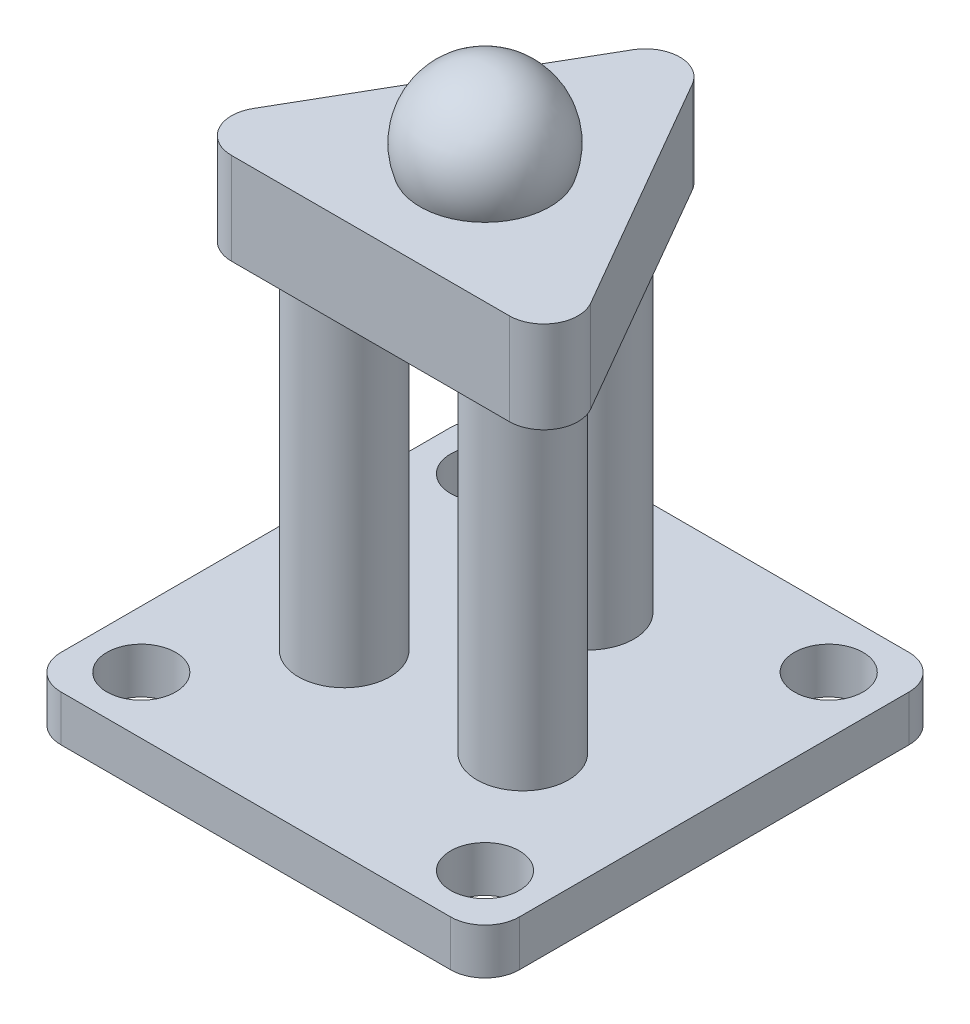
from build123d import *

# Parameters (mm, degrees)
SKETCH_1_R      = 1.5
EXTRUDE_1_DEPTH = 2
SKETCH_2_R      = 2
EXTRUDE_2_DEPTH = 15
EXTRUDE_3_DEPTH = 4


with BuildPart() as part:
    # 草图1 → 凸台-拉伸1 (new body)
    with BuildSketch(Plane(origin=(0, 0, 0), x_dir=(1, 0, 0), z_dir=(0, 1, 0))):
        with BuildLine():
            Line((-8.5, -10), (8.5, -10))
            ThreePointArc((8.5, -10), (9.560660172, -9.560660172), (10, -8.5))
            Line((10, -8.5), (10, 8.5))
            ThreePointArc((10, 8.5), (9.560660172, 9.560660172), (8.5, 10))
            Line((8.5, 10), (-8.5, 10))
            ThreePointArc((-8.5, 10), (-9.560660172, 9.560660172), (-10, 8.5))
            Line((-10, 8.5), (-10, -8.5))
            ThreePointArc((-10, -8.5), (-9.560660172, -9.560660172), (-8.5, -10))
        make_face()
        with Locations((7.5, 7.5)):
            Circle(SKETCH_1_R, mode=Mode.SUBTRACT)
        with Locations((-7.5, 7.5)):
            Circle(SKETCH_1_R, mode=Mode.SUBTRACT)
        with Locations((-7.5, -7.5)):
            Circle(SKETCH_1_R, mode=Mode.SUBTRACT)
        with Locations((7.5, -7.5)):
            Circle(SKETCH_1_R, mode=Mode.SUBTRACT)
    extrude(amount=EXTRUDE_1_DEPTH)

    # 草图2 → 凸台-拉伸2 (add)
    with BuildSketch(Plane(origin=(0, 2, 0), x_dir=(1, 0, 0), z_dir=(0, 1, 0))):
        with Locations((0, 4.5)):
            Circle(SKETCH_2_R)
        with Locations((3.897114317, -2.25)):
            Circle(SKETCH_2_R)
        with Locations((-3.897114317, -2.25)):
            Circle(SKETCH_2_R)
    extrude(amount=EXTRUDE_2_DEPTH)

    # 草图4 → 凸台-拉伸3 (add)
    with BuildSketch(Plane(origin=(0, 17, 0), x_dir=(1, 0, 0), z_dir=(0, 1, 0))):
        with BuildLine():
            Line((-1.299038106, 7.75), (-7.361215932, -2.75))
            ThreePointArc((-7.361215932, -2.75), (-7.361215932, -4.25), (-6.062177826, -5))
            Line((-6.062177826, -5), (6.062177826, -5))
            ThreePointArc((6.062177826, -5), (7.361215932, -4.25), (7.361215932, -2.75))
            Line((7.361215932, -2.75), (1.299038106, 7.75))
            ThreePointArc((1.299038106, 7.75), (0, 8.5), (-1.299038106, 7.75))
        make_face()
    extrude(amount=EXTRUDE_3_DEPTH)

    # 草图7 → 旋转4 (revolve)
    with BuildSketch(Plane.XY):
        with BuildLine():
            Line((0, 25), (0, 19))
            ThreePointArc((0, 19), (2.121320344, 19.878679656), (3, 22))
            ThreePointArc((3, 22), (2.121320344, 24.121320344), (0, 25))
        make_face()
    revolve(axis=Axis((0, 19, 0), (0, 1, 0)))


solid = part.part
